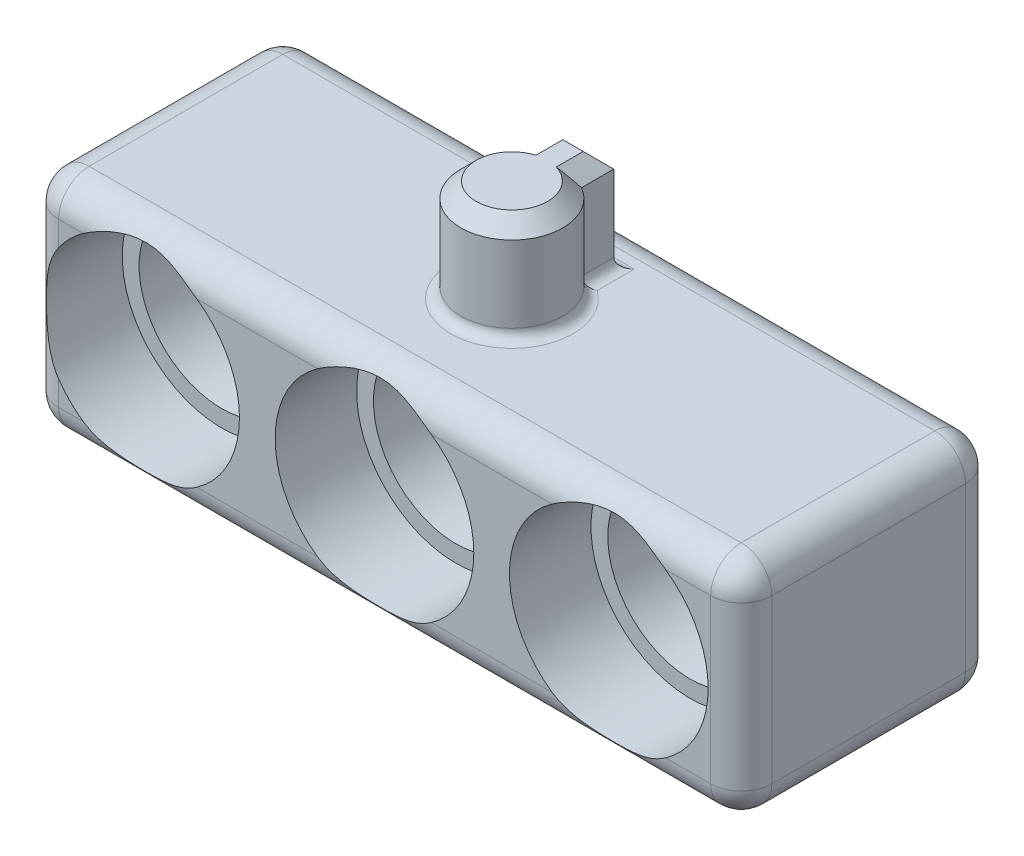
from build123d import *

# Parameters (mm, degrees)
BOSS_EXTRUDE1_DEPTH = 25
SKETCH2_R           = 8.1
CUT_EXTRUDE1_DEPTH  = 49.311489317
SKETCH3_R           = 9.75
CUT_EXTRUDE2_DEPTH  = 8
LPATTERN1_COUNT     = 3
LPATTERN1_PITCH     = 23
FILLET2_R           = 3
BOSS_EXTRUDE2_DEPTH = 10
CHAMFER1_SIZE       = 1.5
FILLET3_R           = 1


with BuildPart() as part:
    # Sketch1 → Boss-Extrude1 (new body)
    with BuildSketch(Plane.XY):
        Polygon((0, 0), (35, 0), (35, 22), (-35, 22), (-35, 0), align=None)
    extrude(amount=BOSS_EXTRUDE1_DEPTH)

    # Sketch2 → Cut-Extrude1 (cut, symmetric)
    with BuildSketch(Plane.XY.offset(25)):
        with Locations((-24, 11)):
            Circle(SKETCH2_R)
    cut_extrude1 = extrude(amount=CUT_EXTRUDE1_DEPTH, both=True, mode=Mode.SUBTRACT)

    # Sketch3 → Cut-Extrude2 (cut)
    with BuildSketch(Plane.XY.offset(25)):
        with Locations((-24, 11)):
            Circle(SKETCH3_R)
    cut_extrude2 = extrude(amount=-CUT_EXTRUDE2_DEPTH, mode=Mode.SUBTRACT)

    # LPattern1: Cut-Extrude1, Cut-Extrude2 ×3
    with Locations(*[(i * LPATTERN1_PITCH, 0, 0) for i in range(1, LPATTERN1_COUNT)]):
        add(cut_extrude1, mode=Mode.SUBTRACT)
        add(cut_extrude2, mode=Mode.SUBTRACT)

    # Fillet2
    # the kernel refuses this fillet: 3 mm, written as the material it takes off along each edge
    with BuildSketch(Plane(origin=(32, 3, 22), x_dir=(1, 0, 0), z_dir=(0, -1, 0))) as fillet2_piece_1_section:
        Polygon((0, 0), (FILLET2_R, 0), (FILLET2_R, FILLET2_R), (0, FILLET2_R), align=None)
    fillet2_piece_1 = extrude(amount=FILLET2_R, mode=Mode.PRIVATE)
    fillet2_piece_1 = fillet2_piece_1 - Plane(origin=(32, 3, 22), x_dir=(-0.7071067811865475, 0, -0.7071067811865475), z_dir=(0, -1, 0)) * Sphere(FILLET2_R, mode=Mode.PRIVATE)
    add(fillet2_piece_1, mode=Mode.SUBTRACT)
    with BuildSketch(Plane(origin=(32, 19, 22), x_dir=(0, 0, 1), z_dir=(1, 0, 0))) as fillet2_piece_2_section:
        Polygon((0, 0), (FILLET2_R, 0), (FILLET2_R, -FILLET2_R), (0, -FILLET2_R), align=None)
    fillet2_piece_2 = extrude(amount=FILLET2_R, mode=Mode.PRIVATE)
    fillet2_piece_2 = fillet2_piece_2 - Plane(origin=(32, 19, 22), x_dir=(0, -0.7071067811865475, -0.7071067811865475), z_dir=(1, 0, 0)) * Sphere(FILLET2_R, mode=Mode.PRIVATE)
    add(fillet2_piece_2, mode=Mode.SUBTRACT)
    with BuildSketch(Plane(origin=(-32, 19, 22), x_dir=(0, 0, 1), z_dir=(-1, 0, 0))) as fillet2_piece_3_section:
        Polygon((0, 0), (FILLET2_R, 0), (FILLET2_R, FILLET2_R), (0, FILLET2_R), align=None)
    fillet2_piece_3 = extrude(amount=FILLET2_R, mode=Mode.PRIVATE)
    fillet2_piece_3 = fillet2_piece_3 - Plane(origin=(-32, 19, 22), x_dir=(0, -0.7071067811865475, -0.7071067811865475), z_dir=(-1, 0, 0)) * Sphere(FILLET2_R, mode=Mode.PRIVATE)
    add(fillet2_piece_3, mode=Mode.SUBTRACT)
    with BuildSketch(Plane(origin=(-32, 3, 22), x_dir=(-1, 0, 0), z_dir=(0, -1, 0))) as fillet2_piece_4_section:
        Polygon((0, 0), (FILLET2_R, 0), (FILLET2_R, -FILLET2_R), (0, -FILLET2_R), align=None)
    fillet2_piece_4 = extrude(amount=FILLET2_R, mode=Mode.PRIVATE)
    fillet2_piece_4 = fillet2_piece_4 - Plane(origin=(-32, 3, 22), x_dir=(0.7071067811865475, 0, -0.7071067811865475), z_dir=(0, -1, 0)) * Sphere(FILLET2_R, mode=Mode.PRIVATE)
    add(fillet2_piece_4, mode=Mode.SUBTRACT)
    with BuildSketch(Plane(origin=(-32, 19, 3), x_dir=(-1, 0, 0), z_dir=(0, 0, -1))) as fillet2_piece_5_section:
        Polygon((0, 0), (FILLET2_R, 0), (FILLET2_R, FILLET2_R), (0, FILLET2_R), align=None)
    fillet2_piece_5 = extrude(amount=FILLET2_R, mode=Mode.PRIVATE)
    fillet2_piece_5 = fillet2_piece_5 - Plane(origin=(-32, 19, 3), x_dir=(0.7071067811865475, -0.7071067811865475, 0), z_dir=(0, 0, -1)) * Sphere(FILLET2_R, mode=Mode.PRIVATE)
    add(fillet2_piece_5, mode=Mode.SUBTRACT)
    with BuildSketch(Plane(origin=(-32, 3, 3), x_dir=(0, 0, -1), z_dir=(0, -1, 0))) as fillet2_piece_6_section:
        Polygon((0, 0), (FILLET2_R, 0), (FILLET2_R, -FILLET2_R), (0, -FILLET2_R), align=None)
    fillet2_piece_6 = extrude(amount=FILLET2_R, mode=Mode.PRIVATE)
    fillet2_piece_6 = fillet2_piece_6 - Plane(origin=(-32, 3, 3), x_dir=(0.7071067811865475, 0, 0.7071067811865475), z_dir=(0, -1, 0)) * Sphere(FILLET2_R, mode=Mode.PRIVATE)
    add(fillet2_piece_6, mode=Mode.SUBTRACT)
    with BuildSketch(Plane(origin=(32, 19, 3), x_dir=(0, 0, -1), z_dir=(1, 0, 0))) as fillet2_piece_7_section:
        Polygon((0, 0), (FILLET2_R, 0), (FILLET2_R, FILLET2_R), (0, FILLET2_R), align=None)
    fillet2_piece_7 = extrude(amount=FILLET2_R, mode=Mode.PRIVATE)
    fillet2_piece_7 = fillet2_piece_7 - Plane(origin=(32, 19, 3), x_dir=(0, -0.7071067811865475, 0.7071067811865475), z_dir=(1, 0, 0)) * Sphere(FILLET2_R, mode=Mode.PRIVATE)
    add(fillet2_piece_7, mode=Mode.SUBTRACT)
    with BuildSketch(Plane(origin=(32, 3, 3), x_dir=(1, 0, 0), z_dir=(0, -1, 0))) as fillet2_piece_8_section:
        Polygon((0, 0), (FILLET2_R, 0), (FILLET2_R, -FILLET2_R), (0, -FILLET2_R), align=None)
    fillet2_piece_8 = extrude(amount=FILLET2_R, mode=Mode.PRIVATE)
    fillet2_piece_8 = fillet2_piece_8 - Plane(origin=(32, 3, 3), x_dir=(-0.7071067811865475, 0, 0.7071067811865475), z_dir=(0, -1, 0)) * Sphere(FILLET2_R, mode=Mode.PRIVATE)
    add(fillet2_piece_8, mode=Mode.SUBTRACT)
    with BuildSketch(Plane(origin=(35, 3, 25), x_dir=(0, 0, -1), z_dir=(0, 1, 0)), Plane(origin=(-35, 19, 25), x_dir=(0, 0, -1), z_dir=(0, -1, 0)), Plane(origin=(-35, 19, 0), x_dir=(1, 0, 0), z_dir=(0, -1, 0))) as fillet2_piece_9:
        with BuildLine():
            CenterArc((FILLET2_R, FILLET2_R), FILLET2_R, 180, 90)
            Line((0, FILLET2_R), (0, 0))
            Line((0, 0), (FILLET2_R, 0))
        make_face()
    extrude(amount=16, mode=Mode.SUBTRACT)
    with BuildSketch(Plane(origin=(32, 22, 25), x_dir=(0, -1, 0), z_dir=(-1, 0, 0)), Plane(origin=(32, 0, 25), x_dir=(0, 0, -1), z_dir=(-1, 0, 0)), Plane(origin=(-32, 0, 0), x_dir=(0, 0, 1), z_dir=(1, 0, 0))) as fillet2_piece_10:
        with BuildLine():
            CenterArc((FILLET2_R, -FILLET2_R), FILLET2_R, 90, 90)
            Line((0, -FILLET2_R), (0, 0))
            Line((0, 0), (FILLET2_R, 0))
        make_face()
    extrude(amount=64, mode=Mode.SUBTRACT)
    with BuildSketch(Plane(origin=(32, 22, 0), x_dir=(0, -1, 0), z_dir=(-1, 0, 0))) as fillet2_piece_11:
        with BuildLine():
            CenterArc((FILLET2_R, FILLET2_R), FILLET2_R, 180, 90)
            Line((0, FILLET2_R), (0, 0))
            Line((0, 0), (FILLET2_R, 0))
        make_face()
    extrude(amount=64, mode=Mode.SUBTRACT)
    with BuildSketch(Plane(origin=(35, 3, 0), x_dir=(0, 0, 1), z_dir=(0, 1, 0))) as fillet2_piece_12:
        with BuildLine():
            CenterArc((FILLET2_R, -FILLET2_R), FILLET2_R, 90, 90)
            Line((0, -FILLET2_R), (0, 0))
            Line((0, 0), (FILLET2_R, 0))
        make_face()
    extrude(amount=16, mode=Mode.SUBTRACT)
    with BuildSketch(Plane(origin=(-35, 0, 3), x_dir=(1, 0, 0), z_dir=(0, 0, 1)), Plane(origin=(-35, 22, 3), x_dir=(0, -1, 0), z_dir=(0, 0, 1))) as fillet2_piece_13:
        with BuildLine():
            CenterArc((FILLET2_R, FILLET2_R), FILLET2_R, 180, 90)
            Line((0, FILLET2_R), (0, 0))
            Line((0, 0), (FILLET2_R, 0))
        make_face()
    extrude(amount=19, mode=Mode.SUBTRACT)
    with BuildSketch(Plane(origin=(35, 22, 3), x_dir=(0, -1, 0), z_dir=(0, 0, 1)), Plane(origin=(35, 0, 3), x_dir=(-1, 0, 0), z_dir=(0, 0, 1))) as fillet2_piece_14:
        with BuildLine():
            CenterArc((FILLET2_R, -FILLET2_R), FILLET2_R, 90, 90)
            Line((0, -FILLET2_R), (0, 0))
            Line((0, 0), (FILLET2_R, 0))
        make_face()
    extrude(amount=19, mode=Mode.SUBTRACT)

    # Sketch5 → Boss-Extrude2 (add)
    with BuildSketch(Plane(origin=(0, 22, 0), x_dir=(1, 0, 0), z_dir=(0, 1, 0))):
        with BuildLine():
            Line((-2.5104146, -8.169868643), (-2.5104146, -4.999995661))
            Line((-2.5104146, -4.999995661), (2.4895854, -4.999995661))
            Line((2.4895854, -4.999995661), (2.4895854, -8.169868643))
            ThreePointArc((2.4895854, -8.169868643), (-0.0104146, -17.499995661), (-2.5104146, -8.169868643))
        make_face()
    extrude(amount=BOSS_EXTRUDE2_DEPTH)

    # Chamfer1
    chamfer1_edges = [part.edges().sort_by_distance(p)[0] for p in [
        (2.4895854, 32, 6.584932152),
        (-0.0104146, 32, 4.999995661),
        (-2.5104146, 32, 6.584932152),
        (-0.0104146, 32, 17.499995661),
    ]]
    chamfer(chamfer1_edges, length=CHAMFER1_SIZE)

    # Fillet3
    fillet3_edges = [part.edges().sort_by_distance(p)[0] for p in [
        (2.4895854, 22, 6.584932152),
        (-0.0104146, 22, 4.999995661),
        (-2.5104146, 22, 6.584932152),
        (-0.0104146, 22, 17.499995661),
    ]]
    fillet(fillet3_edges, radius=FILLET3_R)


solid = part.part
